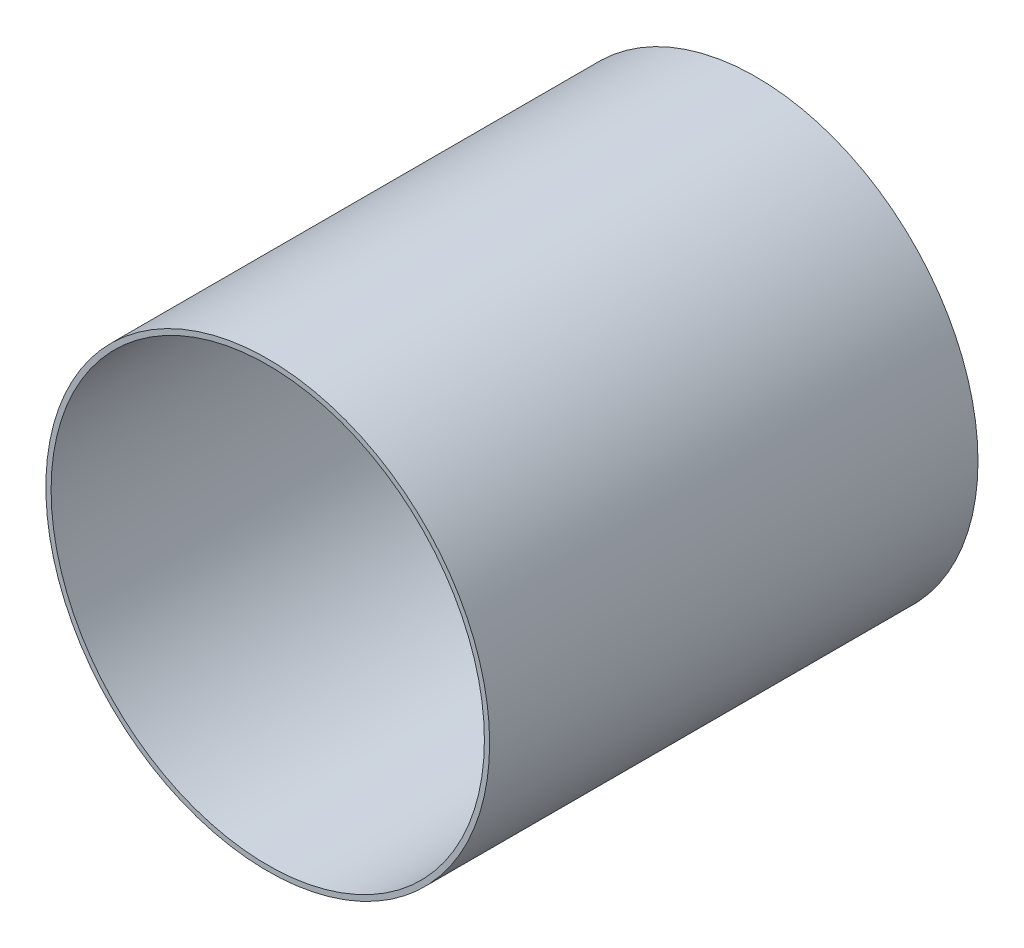
from build123d import *

# Parameters (mm, degrees)
SKETCH1_R           = 63.4746
SKETCH1_R_2         = 61.976
BOSS_EXTRUDE1_DEPTH = 69.85


with BuildPart() as part:
    # Sketch1 → Boss-Extrude1 (new, symmetric)
    with BuildSketch(Plane.XY):
        Circle(SKETCH1_R)
        Circle(SKETCH1_R_2, mode=Mode.SUBTRACT)
    extrude(amount=BOSS_EXTRUDE1_DEPTH, both=True)


solid = part.part
